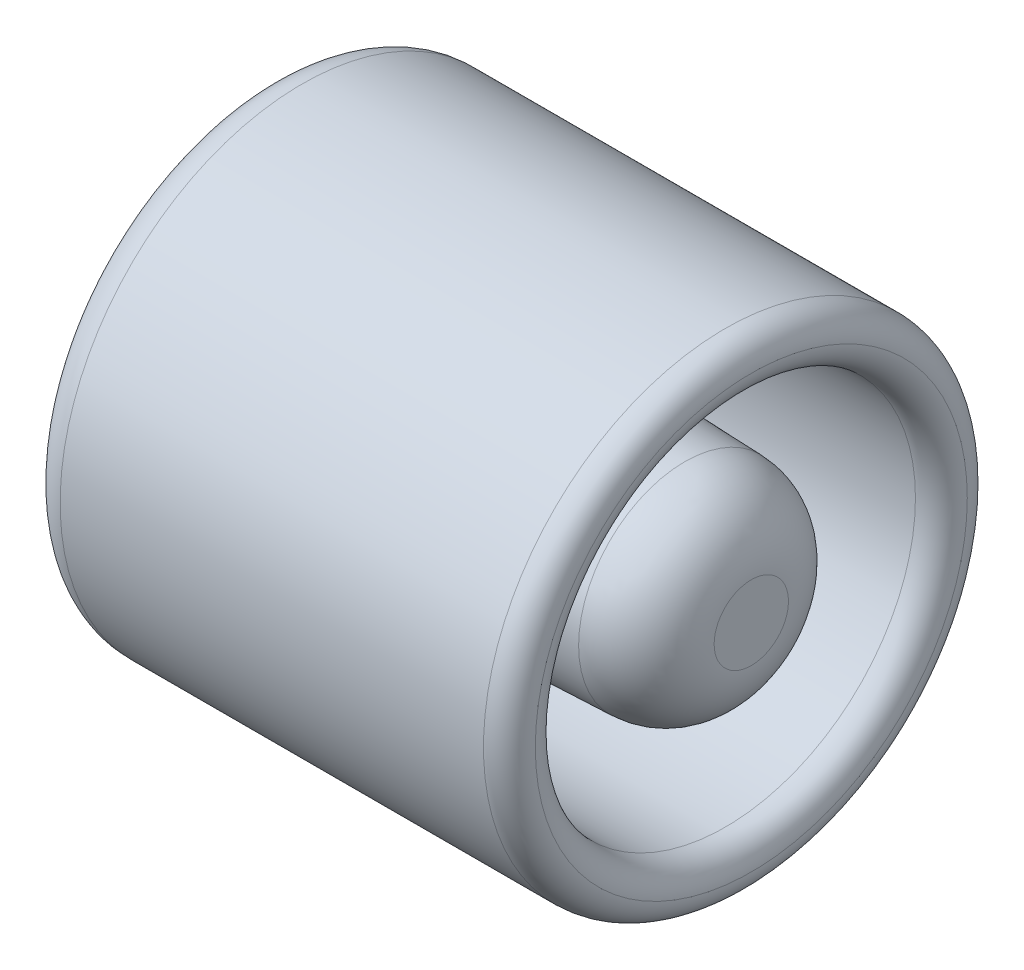
from build123d import *

# Parameters (mm, degrees)
ESTRUSIONE_ESTRUSIONE1_START = 5
SCHIZZO2_R                   = 3.5
SCHIZZO2_R_2                 = 2.75
ESTRUSIONE_ESTRUSIONE1_DEPTH = 5
RACCORDO2_R                  = 0.1
RACCORDO3_R                  = 0.2
RACCORDO6_R                  = 1
RACCORDO7_R                  = 0.375
RACCORDO8_R                  = 0.5


with BuildPart() as part:
    # Schizzo1 → Rivoluzione1 (revolve)
    with BuildSketch(Plane.XY, mode=Mode.PRIVATE) as rivoluzione1_sk:
        Polygon((0, 1.2), (0, 3.5), (2, 3.5), (2, 1.692080625), (7, 1.5), (7, 0), (6, 0), (6, 1.2), align=None)
    revolve(rivoluzione1_sk.sketch.rotate(Axis((-5.29557582, 0, 0), (1, 0, 0)), 90), axis=Axis((-5.29557582, 0, 0), (1, 0, 0)))

    # Schizzo2 → Estrusione-Estrusione1 (add)
    with BuildSketch(Plane(origin=(2, 0, 0), x_dir=(0, 0, -1), z_dir=(1, 0, 0)).offset(ESTRUSIONE_ESTRUSIONE1_START)):
        with Locations(Location((0, 0, 0), (0, 0, 180))):
            Circle(SCHIZZO2_R)
        Circle(SCHIZZO2_R_2, mode=Mode.SUBTRACT)
    extrude(amount=-ESTRUSIONE_ESTRUSIONE1_DEPTH)

    # Raccordo2
    raccordo2_edges = [part.edges().sort_by_distance(p)[0] for p in [
        (0, 0, -1.2),
    ]]
    fillet(raccordo2_edges, radius=RACCORDO2_R)

    # Raccordo3
    raccordo3_edges = [part.edges().sort_by_distance(p)[0] for p in [
        (6, 0, -1.2),
    ]]
    fillet(raccordo3_edges, radius=RACCORDO3_R)

    # Raccordo6
    raccordo6_edges = [part.edges().sort_by_distance(p)[0] for p in [
        (7, 0, -1.5),
    ]]
    fillet(raccordo6_edges, radius=RACCORDO6_R)

    # Raccordo7
    raccordo7_edges = [part.edges().sort_by_distance(p)[0] for p in [
        (7, 0, -3.5),
        (7, 0, 2.75),
    ]]
    fillet(raccordo7_edges, radius=RACCORDO7_R - 0.0001)  # a hair under: the kernel refuses the full size

    # Raccordo8
    raccordo8_edges = [part.edges().sort_by_distance(p)[0] for p in [
        (2, 0, 2.75),
        (2, 0, -1.692080625),
        (0, 0, -3.5),
    ]]
    fillet(raccordo8_edges, radius=RACCORDO8_R)


solid = part.part
